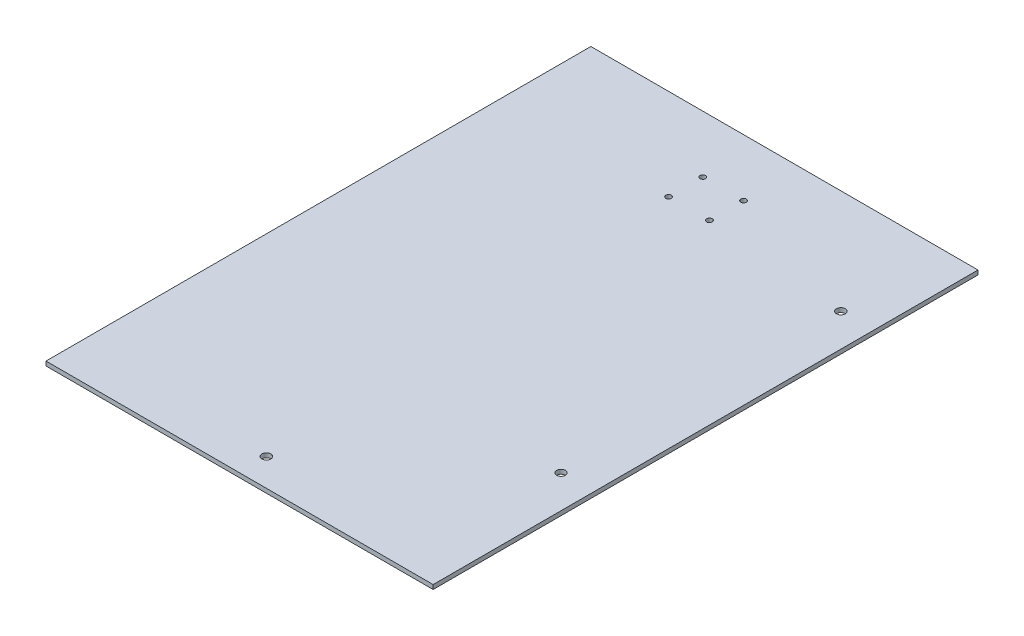
from build123d import *

# Parameters (mm, degrees)
SKETCH1_W           = 270
SKETCH1_H           = 3
BOSS_EXTRUDE1_DEPTH = 380
CUT_EXTRUDE1_REACH  = 471.078
SKETCH6_R           = 1.93305462
SKETCH6_R_2         = 1.937574749
SKETCH6_R_3         = 1.938092279
SKETCH6_R_4         = 1.962476596
CUT_EXTRUDE2_REACH  = 471.078
SKETCH7_R           = 3.018542897
SKETCH7_R_2         = 3.089358341
SKETCH7_R_3         = 3.106196555


with BuildPart() as part:
    # Sketch1 → Boss-Extrude1 (new body)
    with BuildSketch(Plane.XY):
        with Locations((140, 46.5)):
            Rectangle(SKETCH1_W, SKETCH1_H)
    extrude(amount=BOSS_EXTRUDE1_DEPTH)

    # Sketch6 → Cut-Extrude1 (cut, up to next)
    with BuildSketch(Plane.XZ.offset(-45), mode=Mode.PRIVATE) as cut_extrude1_sk1:
        with Locations((122.901099302, 39.846951351)):
            Circle(SKETCH6_R)
    cut_extrude1_tool1 = extrude(cut_extrude1_sk1.sketch, amount=-CUT_EXTRUDE1_REACH, mode=Mode.PRIVATE) & part.part
    # Sketch6 → Cut-Extrude1 (cut, up to next)
    with BuildSketch(Plane.XZ.offset(-45), mode=Mode.PRIVATE) as cut_extrude1_sk2:
        with Locations((122.901099302, 63.66567027)):
            Circle(SKETCH6_R_2)
    cut_extrude1_tool2 = extrude(cut_extrude1_sk2.sketch, amount=-CUT_EXTRUDE1_REACH, mode=Mode.PRIVATE) & part.part
    # Sketch6 → Cut-Extrude1 (cut, up to next)
    with BuildSketch(Plane.XZ.offset(-45), mode=Mode.PRIVATE) as cut_extrude1_sk3:
        with Locations((151.362300698, 39.846951351)):
            Circle(SKETCH6_R_3)
    cut_extrude1_tool3 = extrude(cut_extrude1_sk3.sketch, amount=-CUT_EXTRUDE1_REACH, mode=Mode.PRIVATE) & part.part
    # Sketch6 → Cut-Extrude1 (cut, up to next)
    with BuildSketch(Plane.XZ.offset(-45), mode=Mode.PRIVATE) as cut_extrude1_sk4:
        with Locations((151.362300698, 63.66567027)):
            Circle(SKETCH6_R_4)
    cut_extrude1_tool4 = extrude(cut_extrude1_sk4.sketch, amount=-CUT_EXTRUDE1_REACH, mode=Mode.PRIVATE) & part.part
    add(cut_extrude1_tool1.solids().sort_by_distance((122.901099, 45, 39.846951))[0], mode=Mode.SUBTRACT)
    add(cut_extrude1_tool2.solids().sort_by_distance((122.901099, 45, 63.66567))[0], mode=Mode.SUBTRACT)
    add(cut_extrude1_tool3.solids().sort_by_distance((151.362301, 45, 39.846951))[0], mode=Mode.SUBTRACT)
    add(cut_extrude1_tool4.solids().sort_by_distance((151.362301, 45, 63.66567))[0], mode=Mode.SUBTRACT)

    # Sketch7 → Cut-Extrude2 (cut, up to next)
    with BuildSketch(Plane(origin=(0, 48, 0), x_dir=(1, 0, 0), z_dir=(0, 1, 0)), mode=Mode.PRIVATE) as cut_extrude2_sk1:
        with Locations((252.112318831, -267.889689572)):
            Circle(SKETCH7_R)
    cut_extrude2_tool1 = extrude(cut_extrude2_sk1.sketch, amount=-CUT_EXTRUDE2_REACH, mode=Mode.PRIVATE) & part.part
    # Sketch7 → Cut-Extrude2 (cut, up to next)
    with BuildSketch(Plane(origin=(0, 48, 0), x_dir=(1, 0, 0), z_dir=(0, 1, 0)), mode=Mode.PRIVATE) as cut_extrude2_sk2:
        with Locations((252.112318831, -72.748786013)):
            Circle(SKETCH7_R_2)
    cut_extrude2_tool2 = extrude(cut_extrude2_sk2.sketch, amount=-CUT_EXTRUDE2_REACH, mode=Mode.PRIVATE) & part.part
    # Sketch7 → Cut-Extrude2 (cut, up to next)
    with BuildSketch(Plane(origin=(0, 48, 0), x_dir=(1, 0, 0), z_dir=(0, 1, 0)), mode=Mode.PRIVATE) as cut_extrude2_sk3:
        with Locations((139.467321486, -360.775883093)):
            Circle(SKETCH7_R_3)
    cut_extrude2_tool3 = extrude(cut_extrude2_sk3.sketch, amount=-CUT_EXTRUDE2_REACH, mode=Mode.PRIVATE) & part.part
    add(cut_extrude2_tool1.solids().sort_by_distance((252.112319, 48, 267.88969))[0], mode=Mode.SUBTRACT)
    add(cut_extrude2_tool2.solids().sort_by_distance((252.112319, 48, 72.748786))[0], mode=Mode.SUBTRACT)
    add(cut_extrude2_tool3.solids().sort_by_distance((139.467321, 48, 360.775883))[0], mode=Mode.SUBTRACT)


solid = part.part
